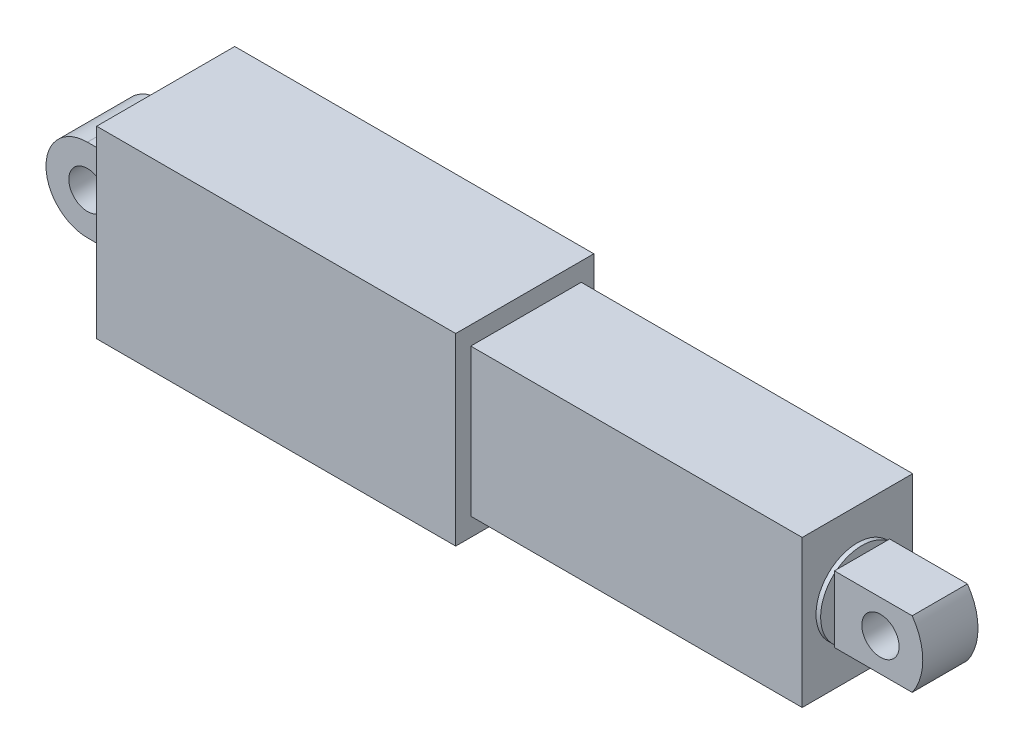
from build123d import *

# Parameters (mm, degrees)
SKETCH_1_W           = 39
SKETCH_1_H           = 20
EXTRUDE_1_DEPTH      = 15
SKETCH_2_W           = 8
SKETCH_2_H           = 9
EXTRUDE_2_DEPTH      = 9
SKETCH_3_R           = 2.025
CUT_EXTRUDE_1_DEPTH  = 10
FILLET_1_R           = 4.5
SKETCH_4_W           = 12
SKETCH_4_H           = 16
EXTRUDE_3_DEPTH      = 36
SKETCH_5_R           = 4.5
EXTRUDE_4_DEPTH      = 0.5
EXTRUDE_5_DEPTH      = 3
EXTRUDE_5_DEPTH_BACK = 3
SKETCH_7_R           = 2.025


with BuildPart() as part:
    # 스케치1 → 보스-돌출1 (new body)
    with BuildSketch(Plane.XY):
        Rectangle(SKETCH_1_W, SKETCH_1_H)
    extrude(amount=EXTRUDE_1_DEPTH)

    # 스케치2 → 보스-돌출2 (add)
    with BuildSketch(Plane.ZY.offset(19.5)):
        with Locations((7.5, 0)):
            Rectangle(SKETCH_2_W, SKETCH_2_H)
    extrude(amount=EXTRUDE_2_DEPTH)

    # 스케치3 → 컷-돌출1 (cut)
    with BuildSketch(Plane.XY.offset(11.5)):
        with Locations((-24, 0)):
            Circle(SKETCH_3_R)
    extrude(amount=-CUT_EXTRUDE_1_DEPTH, mode=Mode.SUBTRACT)

    # 필렛1
    fillet_1_edges = [part.edges().sort_by_distance(p)[0] for p in [
        (-28.5, -4.5, 7.5),
        (-28.5, 4.5, 7.5),
    ]]
    fillet(fillet_1_edges, radius=FILLET_1_R - 0.0001)  # a hair under: the kernel refuses the full size

    # 스케치4 → 보스-돌출3 (add)
    with BuildSketch(Plane(origin=(19.5, 0, 0), x_dir=(0, 0, -1), z_dir=(1, 0, 0))):
        with Locations((-7.366003783, 0)):
            Rectangle(SKETCH_4_W, SKETCH_4_H)
    extrude(amount=EXTRUDE_3_DEPTH)

    # 스케치5 → 보스-돌출4 (add)
    with BuildSketch(Plane(origin=(55.5, 0, 0), x_dir=(0, 0, -1), z_dir=(1, 0, 0))):
        with Locations((-7.366003783, 0)):
            Circle(SKETCH_5_R)
    extrude(amount=EXTRUDE_4_DEPTH)

    # 스케치7 → 보스-돌출5 (add, two sides: drawn at the far end of the back side and taken through both)
    with BuildSketch(Plane.XY.offset(7.366003783).offset(-EXTRUDE_5_DEPTH_BACK)):
        with BuildLine():
            Line((56, -3.604783634), (64.44555705, -3.604783634))
            ThreePointArc((64.44555705, -3.604783634), (65.594419255, 0), (64.44555705, 3.604783634))
            Line((64.44555705, 3.604783634), (56, 3.604783634))
            Line((56, 3.604783634), (56, -3.604783634))
        make_face()
        with Locations((61, 0)):
            Circle(SKETCH_7_R, mode=Mode.SUBTRACT)
    extrude(amount=EXTRUDE_5_DEPTH + EXTRUDE_5_DEPTH_BACK)


solid = part.part
